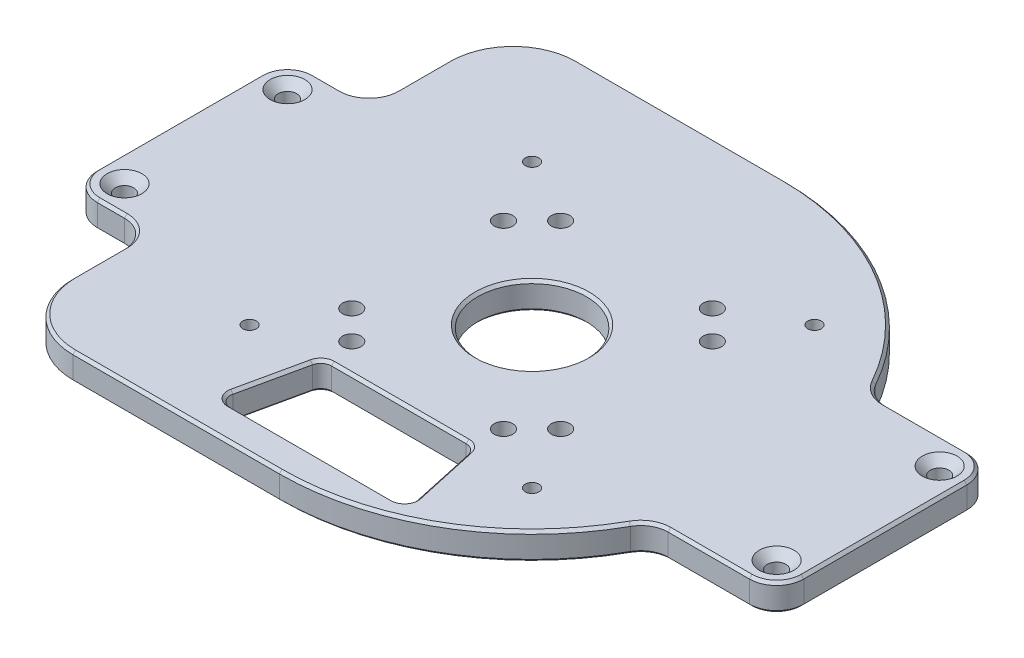
from build123d import *

# Parameters (mm, degrees)
SKETCH_1_W                     = 120
SKETCH_1_H                     = 120
EXTRUDE_1_DEPTH                = 5
FILLET_1_R                     = 10
SKETCH_11_R                    = 1
CUT_EXTRUDE_2_DEPTH            = 10
HOLE_WIZARD_M3_1_D             = 3.4
HOLE_WIZARD_M3_1_DEPTH         = 5
HOLE_WIZARD_M3_1_CSINK_D       = 6.6
HOLE_WIZARD_M3_1_CSINK_ANGLE   = 90
HOLE_WIZARD_M3_1_2_OUTLINE_R   = 1.25
HOLE_WIZARD_M3_1_2_DEPTH       = 5
CUT_EXTRUDE_3_REACH            = 87
FILLET_2_R                     = 2
SKETCH_17_OUTSIDE_W            = 155.956
SKETCH_17_OUTSIDE_H            = 155.956
CUT_EXTRUDE_4_DEPTH            = 10
SKETCH_18_R                    = 1.6
SKETCH_18_W                    = 15
SKETCH_18_H                    = 40
EXTRUDE_2_DEPTH                = 5
FILLET_3_R                     = 5
SKETCH_23_R                    = 10
CUT_EXTRUDE_5_DEPTH            = 10
HOLE_WIZARD_M3_1_3_D           = 3.4
HOLE_WIZARD_M3_1_3_DEPTH       = 6
HOLE_WIZARD_M3_1_3_CSINK_D     = 6.4
HOLE_WIZARD_M3_1_3_CSINK_ANGLE = 90
HOLE_WIZARD_M3_1_3_TIP         = 1.021463052
CHAMFER_2_SIZE                 = 0.5


# Read off the part's stored shape, not the designer's step: M3 螺纹孔1
with BuildPart() as part:
    # 草图1 → 凸台-拉伸1 (new body)
    with BuildSketch(Plane(origin=(0, 0, 0), x_dir=(1, 0, 0), z_dir=(0, 1, 0))):
        Rectangle(SKETCH_1_W, SKETCH_1_H)
    extrude(amount=EXTRUDE_1_DEPTH)

    # 圆角1
    fillet_1_edges = [part.edges().sort_by_distance(p)[0] for p in [
        (60, 2.5, 60),
        (-60, 2.5, 60),
        (-60, 2.5, -60),
        (60, 2.5, -60),
    ]]
    fillet(fillet_1_edges, radius=FILLET_1_R)

    # 草图11 → 切除-拉伸2 (cut)
    with BuildSketch(Plane(origin=(0, 5, 0), x_dir=(1, 0, 0), z_dir=(0, 1, 0))):
        with Locations(Location((-13.959899742, 19.214153616, 0), (0, 0, 270))):
            Circle(SKETCH_11_R)
        with Locations(Location((-19.214153616, 13.959899742, 0), (0, 0, 270))):
            Circle(SKETCH_11_R)
        with Locations(Location((19.214153616, 13.959899742, 0), (0, 0, 270))):
            Circle(SKETCH_11_R)
        with Locations(Location((13.959899742, 19.214153616, 0), (0, 0, 270))):
            Circle(SKETCH_11_R)
        with Locations(Location((-19.214153616, -13.959899742, 0), (0, 0, 270))):
            Circle(SKETCH_11_R)
        with Locations(Location((-13.959899742, -19.214153616, 0), (0, 0, 270))):
            Circle(SKETCH_11_R)
        with Locations(Location((19.214153616, -13.959899742, 0), (0, 0, 270))):
            Circle(SKETCH_11_R)
        with Locations(Location((13.959899742, -19.214153616, 0), (0, 0, 270))):
            Circle(SKETCH_11_R)
    extrude(amount=-CUT_EXTRUDE_2_DEPTH, mode=Mode.SUBTRACT)

    # Hole Wizard M3 _1
    with Locations(Plane(origin=(0, 0, 0), x_dir=(-1, 0, 0), z_dir=(0, -1, 0))):
        with Locations((-13.959899742, 19.214153616), (-19.214153616, 13.959899742), (-19.214153616, -13.959899742), (-13.959899742, -19.214153616), (13.959899742, -19.214153616), (19.214153616, -13.959899742), (13.959899742, 19.214153616), (19.214153616, 13.959899742)):
            CounterSinkHole(HOLE_WIZARD_M3_1_D / 2, HOLE_WIZARD_M3_1_CSINK_D / 2, depth=HOLE_WIZARD_M3_1_DEPTH, counter_sink_angle=HOLE_WIZARD_M3_1_CSINK_ANGLE)

    # Hole Wizard M3 _1 2 outline → Hole Wizard M3 _1 2 (cut)
    with BuildSketch(Plane(origin=(0, 0, 0), x_dir=(1, 0, 0), z_dir=(0, 1, 0))):
        with Locations((-25.986174209, -25.986174209)):
            Circle(HOLE_WIZARD_M3_1_2_OUTLINE_R)
        with Locations((25.986174209, -25.986174209)):
            Circle(HOLE_WIZARD_M3_1_2_OUTLINE_R)
        with Locations((25.986174209, 25.986174209)):
            Circle(HOLE_WIZARD_M3_1_2_OUTLINE_R)
        with Locations((-25.986174209, 25.986174209)):
            Circle(HOLE_WIZARD_M3_1_2_OUTLINE_R)
    extrude(amount=HOLE_WIZARD_M3_1_2_DEPTH, mode=Mode.SUBTRACT)

    # 草图16 → 切除-拉伸3 (cut, up to next)
    with BuildSketch(Plane(origin=(0, 5, 0), x_dir=(1, 0, 0), z_dir=(0, 1, 0)), mode=Mode.PRIVATE) as cut_extrude_3_sk1:
        Polygon((0, -24.5), (14, -24.5), (17.5, -40.5), (0, -40.5), (-17.5, -40.5), (-14, -24.5), align=None)
    cut_extrude_3_tool1 = extrude(cut_extrude_3_sk1.sketch, amount=-CUT_EXTRUDE_3_REACH, mode=Mode.PRIVATE) & part.part
    add(cut_extrude_3_tool1.solids().sort_by_distance((0, 5, 32.796296))[0], mode=Mode.SUBTRACT)

    # 圆角2
    fillet_2_edges = [part.edges().sort_by_distance(p)[0] for p in [
        (-14, 2.5, 24.5),
        (14, 2.5, 24.5),
        (17.5, 2.5, 40.5),
        (-17.5, 2.5, 40.5),
    ]]
    fillet(fillet_2_edges, radius=FILLET_2_R)

    # 草图17 outside → 切除-拉伸4 (cut)
    with BuildSketch(Plane(origin=(0, 5, 0), x_dir=(1, 0, 0), z_dir=(0, 1, 0))):
        Rectangle(SKETCH_17_OUTSIDE_W, SKETCH_17_OUTSIDE_H)
        with BuildLine():
            Line((1e-09, -46.5), (-38, -46.5))
            ThreePointArc((-38, -46.5), (-46.485281374, -42.985281374), (-50, -34.5))
            Line((-50, -34.5), (-50, 34.5))
            ThreePointArc((-50, 34.5), (-46.485281374, 42.985281374), (-38, 46.5))
            Line((-38, 46.5), (1e-09, 46.5))
            ThreePointArc((1e-09, 46.5), (46.5, 0), (1e-09, -46.5))
        make_face(mode=Mode.SUBTRACT)
    extrude(amount=-CUT_EXTRUDE_4_DEPTH, mode=Mode.SUBTRACT)

    # 草图18 → 凸台-拉伸2 (add)
    # profile 1 of 2: a face of its own
    with BuildSketch(Plane(origin=(0, 5, 0), x_dir=(1, 0, 0), z_dir=(0, 1, 0))):
        with BuildLine():
            Line((65, 20), (65, -20))
            Line((65, -20), (41.979161497, -20))
            ThreePointArc((41.979161497, -20), (46.5, 0), (41.979161497, 20))
            Line((41.979161497, 20), (65, 20))
        make_face()
        with Locations(Location((60, 15, 0), (0, 0, 270))):
            Circle(SKETCH_18_R, mode=Mode.SUBTRACT)
        with Locations(Location((60, -15, 0), (0, 0, 270))):
            Circle(SKETCH_18_R, mode=Mode.SUBTRACT)
    # profile 2 of 2: a face of its own
    with BuildSketch(Plane(origin=(0, 5, 0), x_dir=(1, 0, 0), z_dir=(0, 1, 0))):
        with Locations((-57.5, 0)):
            Rectangle(SKETCH_18_W, SKETCH_18_H)
        with Locations(Location((-60, 15, 0), (0, 0, 270))):
            Circle(SKETCH_18_R, mode=Mode.SUBTRACT)
        with Locations(Location((-60, -15, 0), (0, 0, 270))):
            Circle(SKETCH_18_R, mode=Mode.SUBTRACT)
    extrude(amount=-EXTRUDE_2_DEPTH)

    # 圆角3
    fillet_3_edges = [part.edges().sort_by_distance(p)[0] for p in [
        (-50, 2.5, 20),
        (-65, 2.5, 20),
        (-65, 2.5, -20),
        (-50, 2.5, -20),
        (65, 2.5, 20),
        (41.979161497, 2.5, 20),
        (41.979161497, 2.5, -20),
        (65, 2.5, -20),
    ]]
    fillet(fillet_3_edges, radius=FILLET_3_R)

    # 草图23 → 切除-拉伸5 (cut)
    with BuildSketch(Plane.XZ):
        with Locations(Location((0, 0, 0), (0, 0, 270))):
            Circle(SKETCH_23_R)
    extrude(amount=-CUT_EXTRUDE_5_DEPTH, mode=Mode.SUBTRACT)

    # Hole Wizard M3 _1 3
    with Locations(Plane(origin=(0, 5, 0), x_dir=(1, 0, 0), z_dir=(0, 1, 0))):
        with Locations((-60, 15), (-60, -15), (60, 15), (60, -15)):
            CounterSinkHole(HOLE_WIZARD_M3_1_3_D / 2, HOLE_WIZARD_M3_1_3_CSINK_D / 2, depth=HOLE_WIZARD_M3_1_3_DEPTH, counter_sink_angle=HOLE_WIZARD_M3_1_3_CSINK_ANGLE)
            with Locations((0, 0, -(HOLE_WIZARD_M3_1_3_DEPTH + HOLE_WIZARD_M3_1_3_TIP / 2))):  # 118° drill point
                Cone(0, HOLE_WIZARD_M3_1_3_D / 2, HOLE_WIZARD_M3_1_3_TIP, mode=Mode.SUBTRACT)

    # 倒角2
    chamfer_2_edges = [part.edges().sort_by_distance(p)[0] for p in [
        (0, 0, 40.5),
        (0, 5, 40.5),
        (-15.656507616, 0, 32.072606242),
        (-15.656507616, 5, 32.072606242),
        (15.656507616, 0, 32.072606242),
        (15.656507616, 5, 32.072606242),
        (0, 0, 24.5),
        (0, 5, 24.5),
        (-16.573217131, 5, 39.754035981),
        (-16.573217131, 0, 39.754035981),
        (16.573217131, 5, 39.754035981),
        (16.573217131, 0, 39.754035981),
        (13.644243562, 5, 24.94199045),
        (13.644243562, 0, 24.94199045),
        (-13.644243562, 5, 24.94199045),
        (-13.644243562, 0, 24.94199045),
        (23.58616202, 0, 40.07421816),
        (-19, 5, 46.5),
        (-46.485281374, 5, 42.985281374),
        (-50, 0, -29.75),
        (-46.485281374, 0, -42.985281374),
        (-19, 0, -46.5),
        (-19, 0, 46.5),
        (-46.485281374, 0, 42.985281374),
        (23.58616202, 5, 40.07421816),
        (-19, 5, -46.5),
        (-46.485281374, 5, -42.985281374),
        (-50, 5, -29.75),
        (-57.5, 0, -20),
        (-57.5, 5, -20),
        (52.51249653, 5, 20),
        (65, 5, 0),
        (52.51249653, 5, -20),
        (23.58616202, 5, -40.07421816),
        (-65, 5, 0),
        (-57.5, 5, 20),
        (-50, 5, 29.75),
        (63.535533906, 5, -18.535533906),
        (63.535533906, 5, 18.535533906),
        (-63.535533906, 5, 18.535533906),
        (-63.535533906, 5, -18.535533906),
        (-65, 0, 0),
        (-50, 0, 29.75),
        (-57.5, 0, 20),
        (23.58616202, 0, -40.07421816),
        (52.51249653, 0, -20),
        (65, 0, 0),
        (52.51249653, 0, 20),
        (63.535533906, 0, -18.535533906),
        (63.535533906, 0, 18.535533906),
        (-63.535533906, 0, 18.535533906),
        (-63.535533906, 0, -18.535533906),
        (-51.464466094, 5, -21.464466094),
        (-51.464466094, 0, -21.464466094),
        (-51.464466094, 5, 21.464466094),
        (-51.464466094, 0, 21.464466094),
        (42.488846606, 5, 20.690944284),
        (42.488846606, 0, 20.690944284),
        (42.488846606, 5, -20.690944284),
        (42.488846606, 0, -20.690944284),
        (0, 5, 10),
        (0, 0, 10),
    ]]
    chamfer(chamfer_2_edges, length=CHAMFER_2_SIZE)


solid = part.part
